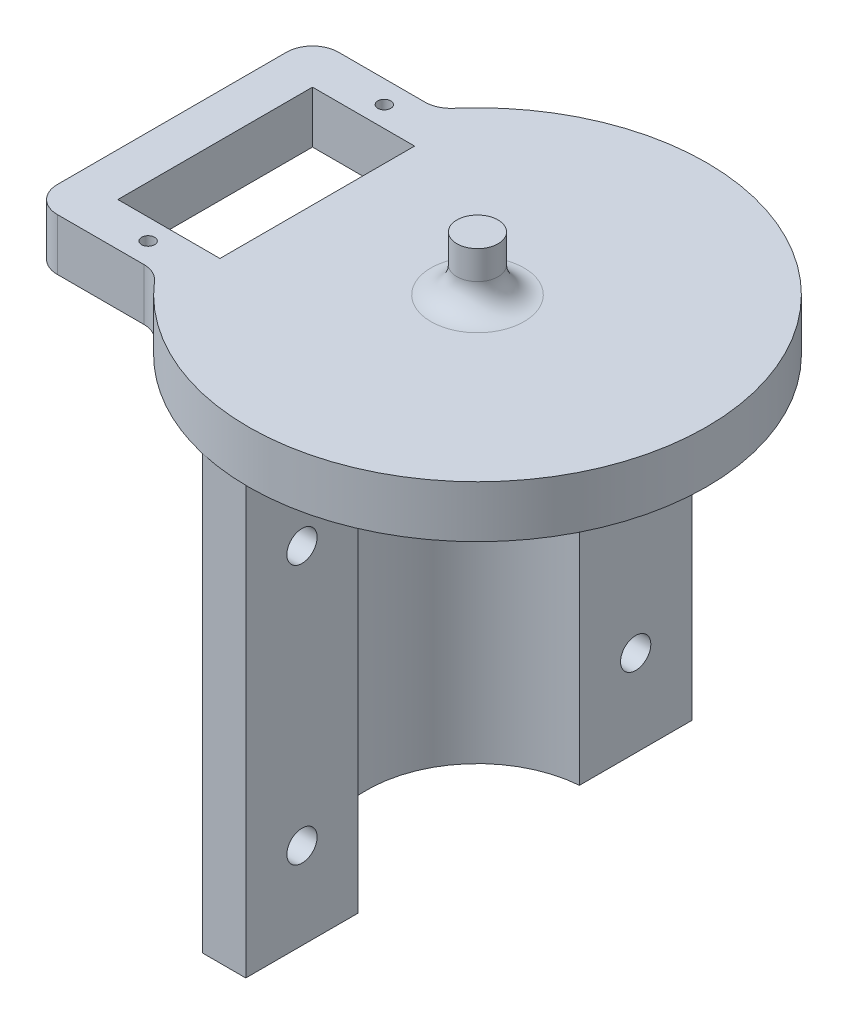
from build123d import *

# Parameters (mm, degrees)
BOSS_EXTRUDE4_DEPTH = 50
SKETCH7_R           = 1.75
CUT_EXTRUDE1_DEPTH  = 59.719147195
SKETCH8_R           = 0.75
SKETCH8_W           = 11.8
SKETCH8_H           = 22.5
BOSS_EXTRUDE5_DEPTH = 6
SKETCH9_R           = 2.38125
BOSS_EXTRUDE6_DEPTH = 6.3
FILLET1_R           = 3


with BuildPart() as part:
    # Sketch6 → Boss-Extrude4 (new body)
    with BuildSketch(Plane.XZ):
        with BuildLine():
            Line((-1, 25.784833184), (-1, 12.785954208))
            ThreePointArc((-1, 12.785954208), (-12.825, 0), (-1, -12.785954208))
            Line((-1, -12.785954208), (-1, -25.784833184))
            Line((-1, -25.784833184), (-6, -25.784833184))
            Line((-6, -25.784833184), (-6, -16.784833184))
            ThreePointArc((-6, -16.784833184), (-17.825, 0), (-6, 16.784833184))
            Line((-6, 16.784833184), (-6, 25.784833184))
            Line((-6, 25.784833184), (-1, 25.784833184))
        make_face()
    extrude(amount=BOSS_EXTRUDE4_DEPTH)

    # Sketch7 → Cut-Extrude1 (cut, through all)
    with BuildSketch(Plane(origin=(-1, 0, 0), x_dir=(0, 0, -1), z_dir=(1, 0, 0))):
        with Locations((-19.285393696, -10)):
            Circle(SKETCH7_R)
        with Locations((-19.285393696, -40)):
            Circle(SKETCH7_R)
        with Locations((19.285393696, -40)):
            Circle(SKETCH7_R)
        with Locations((19.285393696, -10)):
            Circle(SKETCH7_R)
    extrude(amount=-CUT_EXTRUDE1_DEPTH, mode=Mode.SUBTRACT)

    # Sketch8 → Boss-Extrude5 (add)
    with BuildSketch(Plane(origin=(0, 0, 0), x_dir=(1, 0, 0), z_dir=(0, 1, 0))):
        with BuildLine():
            Line((-32.320841509, -16.25), (-22.318992281, -16.25))
            ThreePointArc((-22.318992281, -16.25), (-21.069616181, -16.522536094), (-20.047240136, -17.290627093))
            ThreePointArc((-20.047240136, -17.290627093), (26.473715688, 0), (-20.047240136, 17.290627093))
            ThreePointArc((-20.047240136, 17.290627093), (-21.069616181, 16.522536094), (-22.318992281, 16.25))
            Line((-22.318992281, 16.25), (-32.320841509, 16.25))
            ThreePointArc((-32.320841509, 16.25), (-34.442161852, 15.371320344), (-35.320841509, 13.25))
            Line((-35.320841509, 13.25), (-35.320841509, -13.25))
            ThreePointArc((-35.320841509, -13.25), (-34.442161852, -15.371320344), (-32.320841509, -16.25))
        make_face()
        with Locations((-24.420841509, 13.65)):
            Circle(SKETCH8_R, mode=Mode.SUBTRACT)
        with Locations((-24.420841509, -13.65)):
            Circle(SKETCH8_R, mode=Mode.SUBTRACT)
        with Locations((-24.420841509, 0)):
            Rectangle(SKETCH8_W, SKETCH8_H, mode=Mode.SUBTRACT)
    extrude(amount=BOSS_EXTRUDE5_DEPTH)

    # Sketch9 → Boss-Extrude6 (add)
    with BuildSketch(Plane(origin=(0, 6, 0), x_dir=(1, 0, 0), z_dir=(0, 1, 0))):
        Circle(SKETCH9_R)
    extrude(amount=BOSS_EXTRUDE6_DEPTH)

    # Fillet1
    fillet1_edges = [part.edges().sort_by_distance(p)[0] for p in [
        (-2.38125, 6, 0),
    ]]
    fillet(fillet1_edges, radius=FILLET1_R)


solid = part.part
